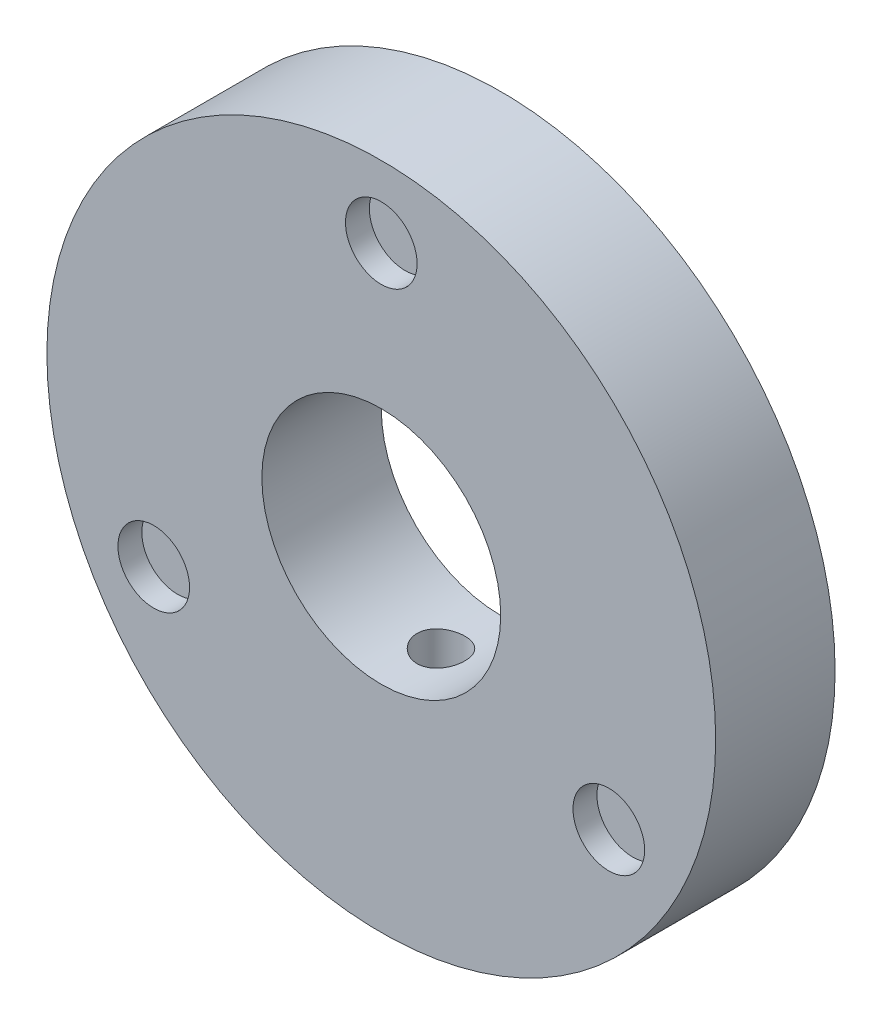
from build123d import *

# Parameters (mm, degrees)
SKETCH3_R           = 14
SKETCH3_R_2         = 5
BOSS_EXTRUDE1_DEPTH = 5
SKETCH4_R           = 1.5
CUT_EXTRUDE1_DEPTH  = 1
CUT_EXTRUDE2_START  = -1
SKETCH5_R           = 1.5
CUT_EXTRUDE2_DEPTH  = 1
SKETCH6_R           = 1
CUT_EXTRUDE3_DEPTH  = 30


with BuildPart() as part:
    # Sketch3 → Boss-Extrude1 (new body)
    with BuildSketch(Plane.XY):
        Circle(SKETCH3_R)
        Circle(SKETCH3_R_2, mode=Mode.SUBTRACT)
    extrude(amount=BOSS_EXTRUDE1_DEPTH)

    # Sketch4 → Cut-Extrude1 (cut)
    with BuildSketch(Plane.XY.offset(5)):
        with Locations((0, 11)):
            Circle(SKETCH4_R)
        with Locations((9.526279442, -5.5)):
            Circle(SKETCH4_R)
        with Locations((-9.526279442, -5.5)):
            Circle(SKETCH4_R)
    extrude(amount=-CUT_EXTRUDE1_DEPTH, mode=Mode.SUBTRACT)

    # Sketch5 → Cut-Extrude2 (cut)
    with BuildSketch(Plane(origin=(0, 0, 0), x_dir=(-1, 0, 0), z_dir=(0, 0, -1)).offset(CUT_EXTRUDE2_START)):
        with Locations((0, 11)):
            Circle(SKETCH5_R)
        with Locations((9.526279442, -5.5)):
            Circle(SKETCH5_R)
        with Locations((-9.526279442, -5.5)):
            Circle(SKETCH5_R)
    extrude(amount=CUT_EXTRUDE2_DEPTH, mode=Mode.SUBTRACT)

    # Sketch6 → Cut-Extrude3 (cut)
    with BuildSketch(Plane(origin=(0, 0, 0), x_dir=(1, 0, 0), z_dir=(0, 1, 0))):
        with Locations((0, -2.5)):
            Circle(SKETCH6_R)
    extrude(amount=-CUT_EXTRUDE3_DEPTH, mode=Mode.SUBTRACT)


solid = part.part
